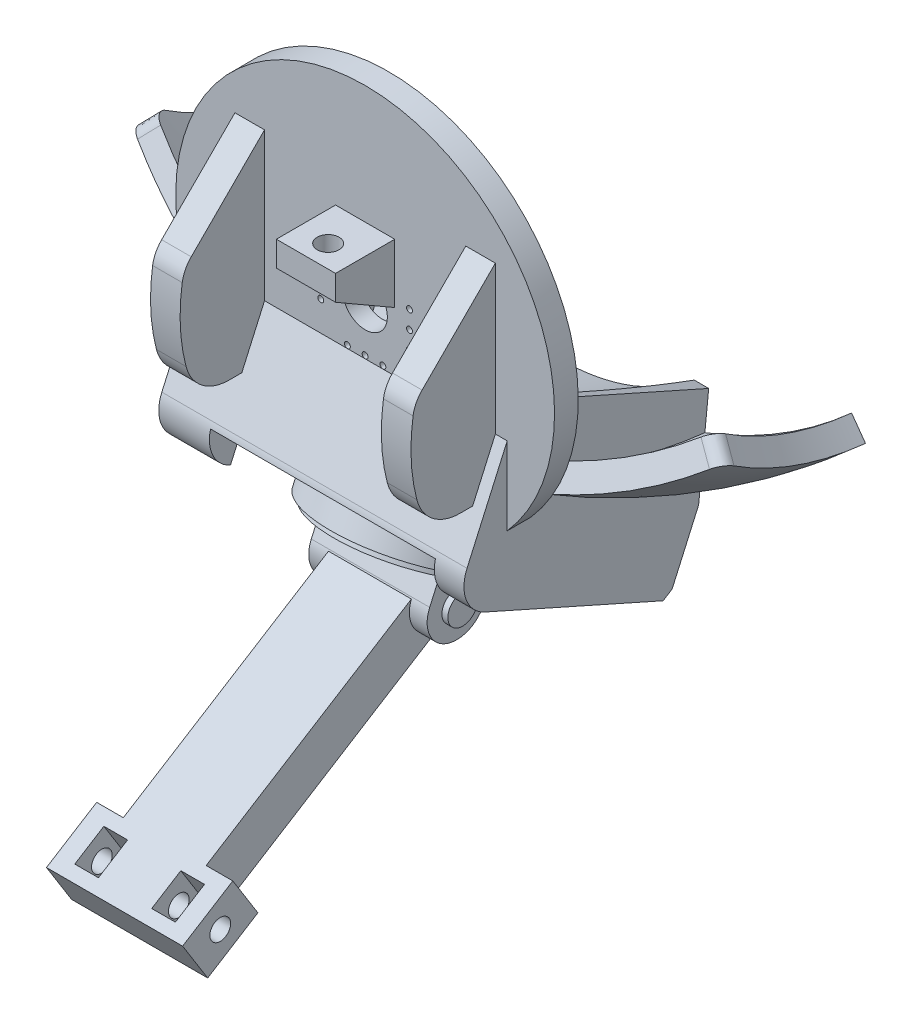
from build123d import *

# Parameters (mm, degrees)
SKETCH1_W                 = 4
SKETCH1_H                 = 32
SKETCH2_W                 = 34
SKETCH2_H                 = 34
BOSS_EXTRUDE1_DEPTH       = 20
FILLET1_R                 = 4
SKETCH6_R                 = 3.5
BOSS_EXTRUDE5_DEPTH       = 21
BOSS_EXTRUDE4_DEPTH       = 5
BOSS_EXTRUDE6_DEPTH       = 24
BOSS_EXTRUDE6_DEPTH_BACK  = 29
CHAMFER1_SIZE             = 2.5
CHAMFER1_SIZE2            = 1.443375673
CUT_EXTRUDE1_DEPTH        = 5
SKETCH11_R                = 15
BOSS_EXTRUDE7_DEPTH       = 5
REVOLVE2_ANGLE            = 31
SKETCH14_W                = 100
SKETCH14_H                = 5
CUT_EXTRUDE3_DEPTH        = 71.072541008
CUT_EXTRUDE4_DEPTH        = 128.360121498
FILLET2_R                 = 2
SKETCH16_R                = 14
BOSS_EXTRUDE8_DEPTH       = 1
SKETCH17_W                = 3
SKETCH17_H                = 10
BOSS_EXTRUDE9_DEPTH       = 10
FILLET3_R                 = 5
BOSS_EXTRUDE10_DEPTH      = 11
BOSS_EXTRUDE10_DEPTH_BACK = 11
SKETCH18_R                = 2.5
BOSS_EXTRUDE11_DEPTH      = 7
BOSS_EXTRUDE11_DEPTH_BACK = 7
CUT_EXTRUDE6_DEPTH        = 150.910272613
CUT_EXTRUDE7_DEPTH        = 148.336654753
CUT_EXTRUDE8_START        = -10
CUT_EXTRUDE8_DEPTH        = 10
BOSS_EXTRUDE14_DEPTH      = 11.5
BOSS_EXTRUDE14_DEPTH_BACK = 11.5
SKETCH29_W                = 4
SKETCH29_H                = 5.8
CUT_EXTRUDE9_DEPTH        = 129.091218174
SKETCH30_R                = 1.75
CUT_EXTRUDE10_DEPTH       = 142.472046033
SKETCH31_W                = 39
SKETCH31_H                = 24.998947646
CUT_EXTRUDE11_DEPTH       = 20
CUT_EXTRUDE12_DEPTH       = 29.977320805
CUT_EXTRUDE12_DEPTH_BACK  = 3
SKETCH32_W                = 2.5
SKETCH32_H                = 20
SKETCH33_W                = 8
SKETCH33_H                = 24
CUT_EXTRUDE13_DEPTH       = 3
SKETCH26_R                = 10.5
CUT_EXTRUDE14_DEPTH       = 1
CUT_EXTRUDE20_START       = -20
SKETCH41_W                = 34
SKETCH41_H                = 25
CUT_EXTRUDE20_DEPTH       = 20
CUT_EXTRUDE21_START       = 55
CUT_EXTRUDE21_OUTLINE_W   = 34
CUT_EXTRUDE21_OUTLINE_H   = 20.233316039
CUT_EXTRUDE21_DEPTH       = 21.450497842
SKETCH45_W                = 10
SKETCH45_H                = 10
BOSS_EXTRUDE17_DEPTH      = 10
CHAMFER3_SIZE2            = 5.773502692
CHAMFER3_SIZE             = 10
CUT_EXTRUDE23_REACH       = 117.427
SKETCH46_R                = 1.85
SKETCH34_R                = 0.5
CUT_EXTRUDE15_DEPTH       = 5
CIRPATTERN1_COUNT         = 4
SKETCH35_R                = 3.75
CUT_EXTRUDE16_DEPTH       = 10
CUT_EXTRUDE17_REACH       = 90.337
SKETCH36_W                = 4
SKETCH36_H                = 20
BOSS_EXTRUDE15_DEPTH      = 14
CHAMFER2_SIZE             = 1
CUT_EXTRUDE18_START       = -22.5
CUT_EXTRUDE18_DEPTH       = 18
CHAMFER4_SIZE             = 1
CHAMFER4_SIZE2            = 1.482560969


with BuildPart() as part:
    # Sketch1 → Revolve1 (revolve)
    with BuildSketch(Plane(origin=(0, 0, 0), x_dir=(0, 0, -1), z_dir=(1, 0, 0)), mode=Mode.PRIVATE) as revolve1_sk:
        with Locations((26, 97)):
            Rectangle(SKETCH1_W, SKETCH1_H)
    revolve(revolve1_sk.sketch.rotate(Axis((0, 81, -24), (0, 0, -1)), 90), axis=Axis((0, 81, -24), (0, 0, -1)))

    # Sketch2 → Boss-Extrude1 (add)
    with BuildSketch(Plane.XY.offset(-24)):
        with Locations((0, 81)):
            Rectangle(SKETCH2_W, SKETCH2_H)
    extrude(amount=BOSS_EXTRUDE1_DEPTH)

    # Fillet1
    fillet1_edges = [part.edges().sort_by_distance(p)[0] for p in [
        (-17, 98, -14),
        (-17, 64, -14),
        (17, 64, -14),
        (17, 98, -14),
    ]]
    fillet(fillet1_edges, radius=FILLET1_R)

    # Sketch6 → Boss-Extrude5 (add)
    with BuildSketch(Plane.XY.offset(-24)):
        with Locations((-10, 64)):
            Circle(SKETCH6_R)
        with Locations((-2.5, 64)):
            Circle(SKETCH6_R)
    extrude(amount=BOSS_EXTRUDE5_DEPTH)

    # Sketch5 → Boss-Extrude4 (add)
    with BuildSketch(Plane.ZY.offset(17)):
        with BuildLine():
            Line((-24, 95.878679656), (-24, 65.878679656))
            Line((-24, 65.878679656), (-24, 64.378679656))
            Line((-24, 64.378679656), (-18, 64.378679656))
            ThreePointArc((-18, 64.378679656), (-13.407206732, 65.949409044), (-10.738156226, 70.003679656))
            ThreePointArc((-10.738156226, 70.003679656), (-9.778946909, 76.271114557), (-10.094291182, 82.603679656))
            ThreePointArc((-10.094291182, 82.603679656), (-10.614769033, 84.232569851), (-11.617642296, 85.617642296))
            Line((-11.617642296, 85.617642296), (-22.939339828, 96.939339828))
            Line((-22.939339828, 96.939339828), (-24, 98))
            Line((-24, 98), (-24, 95.878679656))
        make_face()
    boss_extrude4 = extrude(amount=BOSS_EXTRUDE4_DEPTH)

    # Mirror1: Boss-Extrude4 across plane
    add(boss_extrude4.mirror(Plane(origin=(0, 0, 0), x_dir=(0, 0, 1), z_dir=(1, 0, 0))))

    # Sketch8 → Boss-Extrude6 (add, two sides: drawn at the far end of the back side and taken through both)
    with BuildSketch(Plane(origin=(0, 0, 0), x_dir=(0, 0, -1), z_dir=(1, 0, 0)).offset(-BOSS_EXTRUDE6_DEPTH_BACK)):
        with BuildLine():
            Line((31.001853199, 75.687759622), (24, 73))
            Line((24, 73), (17.208840641, 57.746806342))
            ThreePointArc((17.208840641, 57.746806342), (17.088630828, 53.156178786), (20.249693528, 49.825113738))
            Line((20.249693528, 49.825113738), (51.254059511, 36.021080632))
            Line((51.254059511, 36.021080632), (56.33826755, 47.440398853))
            Line((56.33826755, 47.440398853), (58.041837372, 63.648783017))
            Line((58.041837372, 63.648783017), (31.001853199, 75.687759622))
        make_face()
    extrude(amount=BOSS_EXTRUDE6_DEPTH + BOSS_EXTRUDE6_DEPTH_BACK)

    # Chamfer1
    chamfer1_edges = [part.edges().sort_by_distance(p)[0] for p in [
        (-29, 42.923097185, -35.75187652),
        (-29, 53.156178786, -17.088630828),
        (-29, 65.373403171, -20.60442032),
    ]]
    chamfer1_side = [part.faces().sort_by_distance(p)[0] for p in [
        (-29, 56.351609178, -38.570530073),
    ]]
    chamfer(chamfer1_edges, length=CHAMFER1_SIZE, length2=CHAMFER1_SIZE2, reference=chamfer1_side[0])

    # Sketch10 → Cut-Extrude1 (cut)
    with BuildSketch(Plane(origin=(0, 49.106538634, -21.863639636), x_dir=(1, 0, 0), z_dir=(0, -0.9135454576426004, 0.40673664307580126))):
        Polygon((19, 7.766683961), (-19, 7.766683961), (-19, 1.766683961), (-25, 1.766683961), (-25, -28.171819836), (19, -28.171819836), align=None)
    extrude(amount=-CUT_EXTRUDE1_DEPTH, mode=Mode.SUBTRACT)

    # Sketch11 → Boss-Extrude7 (add)
    with BuildSketch(Plane(origin=(0, 53.674265922, -23.897322851), x_dir=(1, 0, 0), z_dir=(0, -0.9135454576426004, 0.4067366430758013))):
        with Locations(Location((0, -11, 0), (0, 0, 90))):
            Circle(SKETCH11_R)
    extrude(amount=BOSS_EXTRUDE7_DEPTH)

    # Sketch12 → Revolve2 (revolve)
    with BuildSketch(Plane(origin=(0, -17.846986098, -49.476286882), x_dir=(-1, 0, 0), z_dir=(0, -0.10452846326764662, -0.9945218953682741))):
        with BuildLine():
            Line((-47.333333333, 89.657262738), (-50, 86.675838768))
            ThreePointArc((-50, 86.675838768), (0, 67.577538205), (50, 86.675838768))
            Line((50, 86.675838768), (47.333333333, 89.657262738))
            ThreePointArc((47.333333333, 89.657262738), (0, 71.577538205), (-47.333333333, 89.657262738))
        make_face()
    revolve(axis=Axis((0, 118.976887958, -63.857055531), (-1, 0, 0)), revolution_arc=REVOLVE2_ANGLE)

    # Sketch14 → Cut-Extrude3 (cut, through all)
    with BuildSketch(Plane(origin=(0, 74.685811448, -33.252265642), x_dir=(1, 0, 0), z_dir=(0, 0.9135454576425986, -0.40673664307580537))):
        with Locations((0, -2.5)):
            Rectangle(SKETCH14_W, SKETCH14_H)
    extrude(amount=CUT_EXTRUDE3_DEPTH, mode=Mode.SUBTRACT)

    # Sketch15 → Cut-Extrude4 (cut, through all)
    with BuildSketch(Plane(origin=(0, 0, -28), x_dir=(-1, 0, 0), z_dir=(0, 0, -1))):
        with BuildLine():
            Line((-31.513326273, 86.559700282), (-55.043150404, 86.559700282))
            Line((-55.043150404, 86.559700282), (-29.919773925, 69.65067719))
            ThreePointArc((-29.919773925, 69.65067719), (-31.858832613, 77.997536923), (-31.513326273, 86.559700282))
        make_face()
        with BuildLine():
            Line((55.043150404, 86.559700282), (29.919773925, 69.65067719))
            ThreePointArc((29.919773925, 69.65067719), (31.858832613, 77.997536923), (31.513326273, 86.559700282))
            Line((31.513326273, 86.559700282), (55.043150404, 86.559700282))
        make_face()
    extrude(amount=-CUT_EXTRUDE4_DEPTH, mode=Mode.SUBTRACT)

    # Fillet2
    fillet2_edges = [part.edges().sort_by_distance(p)[0] for p in [
        (48.666185859, 78.806391764, -35.086866199),
        (-48.666185859, 78.806391764, -35.086866199),
    ]]
    fillet(fillet2_edges, radius=FILLET2_R)

    # Sketch16 → Boss-Extrude8 (add)
    with BuildSketch(Plane(origin=(0, 49.106538634, -21.863639636), x_dir=(1, 0, 0), z_dir=(0, -0.9135454576426004, 0.4067366430758013))):
        with Locations(Location((0, -11, 0), (0, 0, 270))):
            Circle(SKETCH16_R)
    extrude(amount=BOSS_EXTRUDE8_DEPTH)

    # Sketch17 → Boss-Extrude9 (add)
    with BuildSketch(Plane(origin=(0, 48.192993176, -21.456902993), x_dir=(1, 0, 0), z_dir=(0, -0.9135454576426004, 0.4067366430758013))):
        with Locations((-8.5, -11)):
            Rectangle(SKETCH17_W, SKETCH17_H)
        with Locations((8.5, -11)):
            Rectangle(SKETCH17_W, SKETCH17_H)
    extrude(amount=BOSS_EXTRUDE9_DEPTH)

    # Fillet3
    fillet3_edges = [part.edges().sort_by_distance(p)[0] for p in [
        (8.5, 32.549752311, -32.006263885),
        (8.5, 36.617118741, -22.870809308),
        (-8.5, 32.549752311, -32.006263885),
        (-8.5, 36.617118741, -22.870809308),
    ]]
    fillet(fillet3_edges, radius=FILLET3_R - 0.0001)  # a hair under: the kernel refuses the full size

    # Sketch18 → Boss-Extrude10 (add, two sides: drawn at the far end of the back side and taken through both)
    with BuildSketch(Plane(origin=(0, 0, 0), x_dir=(0, 0, -1), z_dir=(1, 0, 0)).offset(-BOSS_EXTRUDE10_DEPTH_BACK)):
        with Locations((29.472219812, 39.151162814)):
            Circle(SKETCH18_R)
    extrude(amount=BOSS_EXTRUDE10_DEPTH + BOSS_EXTRUDE10_DEPTH_BACK)

    # Sketch19 → Boss-Extrude11 (add, two sides: drawn at the far end of the back side and taken through both)
    with BuildSketch(Plane(origin=(0, 0, 0), x_dir=(0, 0, -1), z_dir=(1, 0, 0)).offset(-BOSS_EXTRUDE11_DEPTH_BACK)):
        Polygon((-9.858637787, 19.29122893), (27.352542755, 42.543355199), (36.583230482, 48.311329057), (40.822584596, 41.526944287), (31.591896869, 35.75897043), (-9.536250046, 10.059251922), align=None)
    extrude(amount=BOSS_EXTRUDE11_DEPTH + BOSS_EXTRUDE11_DEPTH_BACK)

    # Sketch22 → Cut-Extrude6 (cut, through all)
    with BuildSketch(Plane.ZY.offset(29)):
        Polygon((-33.862459198, 76.056328613), (-26.096721215, 58.614195528), (-25.276378018, 67.77859965), (-28, 71.392968097), (-29.918482828, 83.52797246), align=None)
    extrude(amount=CUT_EXTRUDE6_DEPTH, mode=Mode.SUBTRACT)

    # Sketch24 → Cut-Extrude7 (cut, through all)
    with BuildSketch(Plane(origin=(24, 0, 0), x_dir=(0, 0, -1), z_dir=(1, 0, 0))):
        Polygon((33.862459198, 76.056328613), (28.211358934, 63.363749607), (28, 63.363749607), (28, 74.53545614), (31.001853199, 75.687759622), align=None)
    extrude(amount=CUT_EXTRUDE7_DEPTH, mode=Mode.SUBTRACT)

    # Sketch25 → Cut-Extrude8 (cut)
    with BuildSketch(Plane(origin=(0, 0, -28), x_dir=(-1, 0, 0), z_dir=(0, 0, -1)).offset(CUT_EXTRUDE8_START)):
        with BuildLine():
            Line((-32.5084646, 71.392968097), (-38.134327203, 71.392968097))
            add(Edge.make_bspline(
                [(-38.134327203, 71.392968097), (-36.477248939, 70.167781572), (-34.767119143, 69.014339761), (-33.008804526, 67.935816953), (-30.373035757, 66.471137376), (-29.529410915, 66.024103649), (-28.677053697, 65.593954957), (-27.816482516, 65.18091973)],
                knots=[0, 0, 0, 0, 0, 0.507824521, 0.507824521, 0.507824521, 0.743043932, 0.743043932, 0.743043932, 0.743043932, 0.743043932], degree=4))
            ThreePointArc((-27.816482515, 65.180919733), (-28.954507591, 67.375151739), (-29.919773925, 69.65067719))
            Line((-29.919773925, 69.65067719), (-32.5084646, 71.392968097))
        make_face()
    extrude(amount=CUT_EXTRUDE8_DEPTH, mode=Mode.SUBTRACT)

    # Sketch27 → Cut-Revolve1 (revolve, cut)
    with BuildSketch(Plane(origin=(0, 0, 0), x_dir=(0, 0, -1), z_dir=(1, 0, 0))):
        Polygon((28, 64), (68, 53.282032303), (68, 76), (28, 76), align=None)
    revolve(axis=Axis((0, 90, -38), (0, 0, -1)), mode=Mode.SUBTRACT)

    # Sketch28 → Boss-Extrude14 (add, two sides: drawn at the far end of the back side and taken through both)
    with BuildSketch(Plane(origin=(0, 0, 0), x_dir=(0, 0, -1), z_dir=(1, 0, 0)).offset(-BOSS_EXTRUDE14_DEPTH_BACK)):
        Polygon((-9.858637787, 19.29122893), (-5.619283673, 12.506844161), (-14.099764635, 7.207651518), (-18.339118749, 13.992036288), align=None)
    extrude(amount=BOSS_EXTRUDE14_DEPTH + BOSS_EXTRUDE14_DEPTH_BACK)

    # Sketch29 → Cut-Extrude9 (cut, through all)
    with BuildSketch(Plane(origin=(0, 18.304416013, 11.437868571), x_dir=(1, 0, 0), z_dir=(0, 0.8480480961564254, 0.5299192642332058))):
        with Locations((6.5, -3.137805165)):
            Rectangle(SKETCH29_W, SKETCH29_H)
        with Locations((-6.5, -3.137805165)):
            Rectangle(SKETCH29_W, SKETCH29_H)
    extrude(amount=-CUT_EXTRUDE9_DEPTH, mode=Mode.SUBTRACT)

    # Sketch30 → Cut-Extrude10 (cut, through all)
    with BuildSketch(Plane(origin=(11.5, 0, 0), x_dir=(0, 0, -1), z_dir=(1, 0, 0))):
        with Locations((-11.979201211, 13.249440224)):
            Circle(SKETCH30_R)
    extrude(amount=-CUT_EXTRUDE10_DEPTH, mode=Mode.SUBTRACT)

    # Sketch31 → Cut-Extrude11 (cut)
    with BuildSketch(Plane(origin=(0, 74.685811448, -33.252265642), x_dir=(1, 0, 0), z_dir=(0, 0.9135454576425989, -0.40673664307580487))):
        with Locations((-4.5, 10.036090721)):
            Rectangle(SKETCH31_W, SKETCH31_H)
    extrude(amount=-CUT_EXTRUDE11_DEPTH, mode=Mode.SUBTRACT)

    # Sketch32 → Cut-Extrude12 (cut, two sides: drawn at the far end of the back side and taken through both)
    with BuildSketch(Plane(origin=(0, 1.001948174, 2.250412443), x_dir=(-1, 0, 0), z_dir=(0, -0.4067366430758048, -0.9135454576425989)).offset(-CUT_EXTRUDE12_DEPTH_BACK)):
        with Locations((3.25, 71.753798701)):
            Rectangle(SKETCH32_W, SKETCH32_H)
    extrude(amount=CUT_EXTRUDE12_DEPTH + CUT_EXTRUDE12_DEPTH_BACK, mode=Mode.SUBTRACT)

    # Sketch33 → Cut-Extrude13 (cut)
    with BuildSketch(Plane(origin=(0, 56.414902295, -25.117532781), x_dir=(1, 0, 0), z_dir=(0, 0.9135454576425988, -0.40673664307580515))):
        with Locations((-19, 10.233316039)):
            Rectangle(SKETCH33_W, SKETCH33_H)
    extrude(amount=-CUT_EXTRUDE13_DEPTH, mode=Mode.SUBTRACT)

    # Sketch26 → Cut-Extrude14 (cut)
    with BuildSketch(Plane(origin=(0, 0, -28), x_dir=(-1, 0, 0), z_dir=(0, 0, -1))):
        with Locations((0, 81)):
            Circle(SKETCH26_R)
    extrude(amount=-CUT_EXTRUDE14_DEPTH, mode=Mode.SUBTRACT)

    # Sketch41 → Cut-Extrude20 (cut)
    with BuildSketch(Plane.XY.offset(-4).offset(CUT_EXTRUDE20_START)):
        with Locations((0, 85.5)):
            Rectangle(SKETCH41_W, SKETCH41_H)
    extrude(amount=CUT_EXTRUDE20_DEPTH, mode=Mode.SUBTRACT)

    # Cut-Extrude21: read off the stored shape, not the designer's step
    # Cut-Extrude21 outline → Cut-Extrude21 (cut)
    with BuildSketch(Plane(origin=(0, 0, 0), x_dir=(1, 0, 0), z_dir=(0, 0.9135454576426005, -0.4067366430758012)).offset(CUT_EXTRUDE21_START)):
        with Locations((0, -17.88334198)):
            Rectangle(CUT_EXTRUDE21_OUTLINE_W, CUT_EXTRUDE21_OUTLINE_H)
    extrude(amount=CUT_EXTRUDE21_DEPTH, mode=Mode.SUBTRACT)

    # Sketch45 → Boss-Extrude17 (add)
    with BuildSketch(Plane.XY.offset(-24)):
        with Locations((0, 88)):
            Rectangle(SKETCH45_W, SKETCH45_H)
    extrude(amount=BOSS_EXTRUDE17_DEPTH)

    # Chamfer3
    chamfer3_edges = [part.edges().sort_by_distance(p)[0] for p in [
        (0, 83, -14),
    ]]
    chamfer3_side = [part.faces().sort_by_distance(p)[0] for p in [
        (0, 83, -14.115470054),
    ]]
    chamfer(chamfer3_edges, length=CHAMFER3_SIZE - 0.0001, length2=CHAMFER3_SIZE2 - 0.0001, reference=chamfer3_side[0])  # a hair under: the kernel refuses the full size

    # Sketch46 → Cut-Extrude23 (cut, up to next)
    with BuildSketch(Plane(origin=(0, 93, 0), x_dir=(1, 0, 0), z_dir=(0, 1, 0)), mode=Mode.PRIVATE) as cut_extrude23_sk1:
        with Locations(Location((0, 17.75, 0), (0, 0, 270))):
            Circle(SKETCH46_R)
    cut_extrude23_tool1 = extrude(cut_extrude23_sk1.sketch, amount=-CUT_EXTRUDE23_REACH, mode=Mode.PRIVATE) & part.part
    add(cut_extrude23_tool1.solids().sort_by_distance((0, 93, -17.75))[0], mode=Mode.SUBTRACT)

    # Sketch34 → Cut-Extrude15 (cut)
    with BuildSketch(Plane(origin=(0, 0, -27), x_dir=(-1, 0, 0), z_dir=(0, 0, -1))):
        with Locations((-3, 88.5)):
            Circle(SKETCH34_R)
        with Locations((0, 88.5)):
            Circle(SKETCH34_R)
        with Locations((3, 88.5)):
            Circle(SKETCH34_R)
    cut_extrude15 = extrude(amount=-CUT_EXTRUDE15_DEPTH, mode=Mode.SUBTRACT)

    # CirPattern1: Cut-Extrude15 ×4 about axis
    cirpattern1_axis = Axis((0, 81, 0), (0, 0, 1))
    for i in range(1, CIRPATTERN1_COUNT):
        add(cut_extrude15.rotate(cirpattern1_axis, i * 360 / CIRPATTERN1_COUNT), mode=Mode.SUBTRACT)

    # Sketch35 → Cut-Extrude16 (cut)
    with BuildSketch(Plane(origin=(0, 0, -27), x_dir=(-1, 0, 0), z_dir=(0, 0, -1))):
        with Locations((0, 81)):
            Circle(SKETCH35_R)
    extrude(amount=-CUT_EXTRUDE16_DEPTH, mode=Mode.SUBTRACT)

    # Sketch36 → Cut-Extrude17 (cut, up to next)
    with BuildSketch(Plane(origin=(0, 53.674265922, -23.897322851), x_dir=(1, 0, 0), z_dir=(0, -0.9135454576426004, 0.4067366430758015)), mode=Mode.PRIVATE) as cut_extrude17_sk1:
        with Locations((17, -11)):
            Rectangle(SKETCH36_W, SKETCH36_H)
    cut_extrude17_tool1 = extrude(cut_extrude17_sk1.sketch, amount=-CUT_EXTRUDE17_REACH, mode=Mode.PRIVATE) & part.part
    add(cut_extrude17_tool1.solids().sort_by_distance((17, 49.200163, -33.946323))[0], mode=Mode.SUBTRACT)

    # Sketch37 → Boss-Extrude15 (add)
    with BuildSketch(Plane(origin=(-7, 0, 0), x_dir=(0, 0, -1), z_dir=(1, 0, 0))):
        with BuildLine():
            Line((26.938175739, 45.752573318), (24.904492523, 41.18484603))
            ThreePointArc((24.904492523, 41.18484603), (24.854997538, 41.069823408), (24.808398466, 40.953597406))
            Line((24.808398466, 40.953597406), (30.179134274, 44.30960561))
            Line((30.179134274, 44.30960561), (26.938175739, 45.752573318))
        make_face()
    extrude(amount=BOSS_EXTRUDE15_DEPTH)

    # Chamfer2
    chamfer2_edges = [part.edges().sort_by_distance(p)[0] for p in [
        (3.275817755, 90.975921914, -28),
    ]]
    chamfer(chamfer2_edges, length=CHAMFER2_SIZE - 0.0001)  # a hair under: the kernel refuses the full size

    # Cut-Extrude18: read off the stored shape, not the designer's step
    # Cut-Extrude18 outline → Cut-Extrude18 (cut)
    with BuildSketch(Plane.YZ.offset(CUT_EXTRUDE18_START)):
        Polygon((68.945486948, -28), (75.687759622, -31.001853199), (74.53545614, -28), align=None)
    extrude(amount=CUT_EXTRUDE18_DEPTH, mode=Mode.SUBTRACT)

    # Chamfer4
    chamfer4_edges = [part.edges().sort_by_distance(p)[0] for p in [
        (-1.778312164, 36.021080632, -51.254059511),
    ]]
    chamfer4_side = [part.faces().sort_by_distance(p)[0] for p in [
        (-1.778312164, 36.272136582, -50.690178615),
    ]]
    chamfer(chamfer4_edges, length=CHAMFER4_SIZE, length2=CHAMFER4_SIZE2, reference=chamfer4_side[0])


solid = part.part
